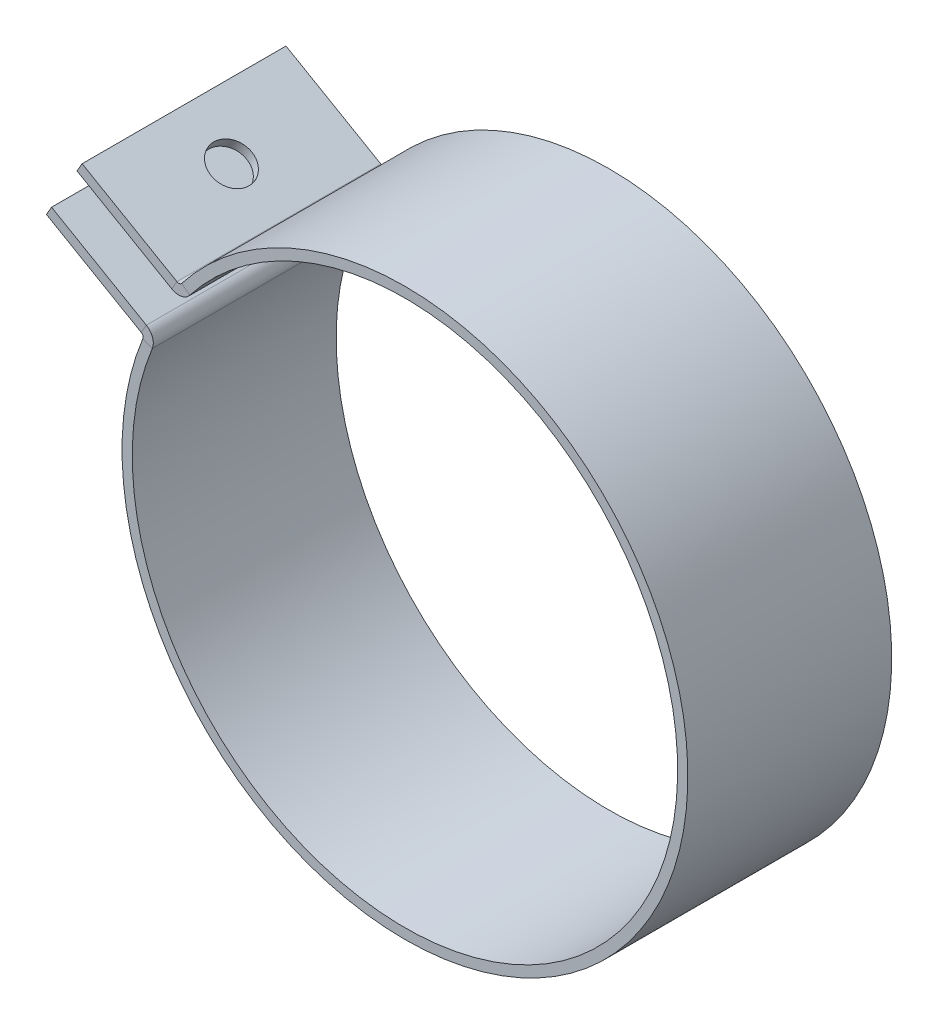
from build123d import *

# Parameters (mm, degrees)
SM_BASE_FLANGE_1_DEPTH = 40
SKETCH_6_R             = 4
CUT_EXTRUDE_1_DEPTH    = 162.312299626


# Read off the part's stored shape, not the designer's step: Базовая кромка1
with BuildPart() as part:
    # Базовая кромка1 outline → Базовая кромка1 (new body)
    with BuildSketch(Plane.XY):
        with BuildLine():
            Line((-44.739249061, 168.913121258), (-63.336309448, 179.650139078))
            Line((-63.336309448, 179.650139078), (-64.336309448, 177.91808827))
            Line((-64.336309448, 177.91808827), (-45.739249061, 167.18107045))
            ThreePointArc((-45.739249061, 167.18107045), (-43.846610356, 166.865137493), (-42.211758442, 167.869704125))
            ThreePointArc((-42.211758442, 167.869704125), (46.332359104, 108.250000003), (-49.571878008, 155.121603086))
            ThreePointArc((-49.571878008, 155.121603086), (-49.519323742, 157.039709692), (-50.739249061, 158.520816412))
            Line((-50.739249061, 158.520816412), (-69.336309448, 169.257834232))
            Line((-69.336309448, 169.257834232), (-70.336309448, 167.525783425))
            Line((-70.336309448, 167.525783425), (-51.739249061, 156.788765605))
            ThreePointArc((-51.739249061, 156.788765605), (-51.410886498, 156.390101858), (-51.425032326, 155.873812548))
            ThreePointArc((-51.425032326, 155.873812548), (48.064409909, 107.249999999), (-43.789768103, 169.098478111))
            ThreePointArc((-43.789768103, 169.098478111), (-44.229814847, 168.82808281), (-44.739249061, 168.913121258))
        make_face()
    extrude(amount=SM_BASE_FLANGE_1_DEPTH)

    # Эскиз6 → Вырез-Вытянуть1 (cut, through all)
    with BuildSketch(Plane(origin=(61.956714755, 107.312177826, 0), x_dir=(0.8660254037844433, -0.499999999999992, 0), z_dir=(0.499999999999992, 0.8660254037844433, 0))):
        with Locations(Location((-133.938904682, -20, 0), (0, 0, 180))):
            Circle(SKETCH_6_R)
    extrude(amount=-CUT_EXTRUDE_1_DEPTH, mode=Mode.SUBTRACT)


solid = part.part
